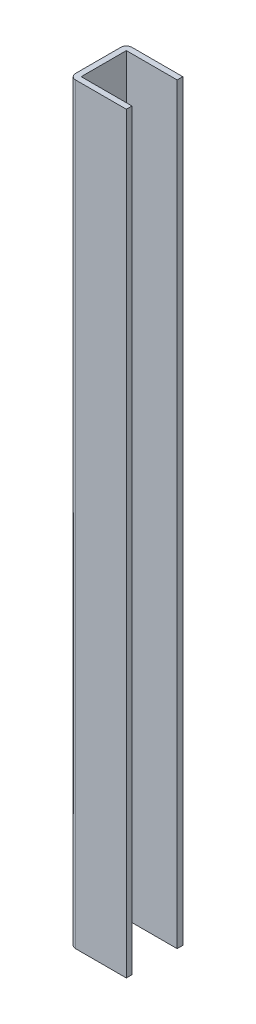
from build123d import *

# Parameters (mm, degrees)
SKETCH_1_W          = 74
SKETCH_1_H          = 24
EXTRUDE_1_DEPTH     = 400
SKETCH_2_W          = 51.146480438
SKETCH_2_H          = 44.035025014
CUT_EXTRUDE_1_DEPTH = 403.27478171


with BuildPart() as part:
    # Эскиз1 → Вытянуть-Тонкостенный1 (new body)
    with BuildSketch(Plane(origin=(0, 0, 0), x_dir=(1, 0, 0), z_dir=(0, 1, 0))):
        with BuildLine():
            Line((40, 12), (40, -12))
            ThreePointArc((40, -12), (39.121320344, -14.121320344), (37, -15))
            Line((37, -15), (-37, -15))
            ThreePointArc((-37, -15), (-39.121320344, -14.121320344), (-40, -12))
            Line((-40, -12), (-40, 12))
            ThreePointArc((-40, 12), (-39.121320344, 14.121320344), (-37, 15))
            Line((-37, 15), (37, 15))
            ThreePointArc((37, 15), (39.121320344, 14.121320344), (40, 12))
        make_face()
        Rectangle(SKETCH_1_W, SKETCH_1_H, mode=Mode.SUBTRACT)
    extrude(amount=EXTRUDE_1_DEPTH)

    # Эскиз2 → Вырез-Вытянуть1 (cut, through all)
    with BuildSketch(Plane(origin=(0, 400, 0), x_dir=(1, 0, 0), z_dir=(0, 1, 0))):
        with Locations((15.573240219, -1.044738789)):
            Rectangle(SKETCH_2_W, SKETCH_2_H)
    extrude(amount=-CUT_EXTRUDE_1_DEPTH, mode=Mode.SUBTRACT)


solid = part.part
